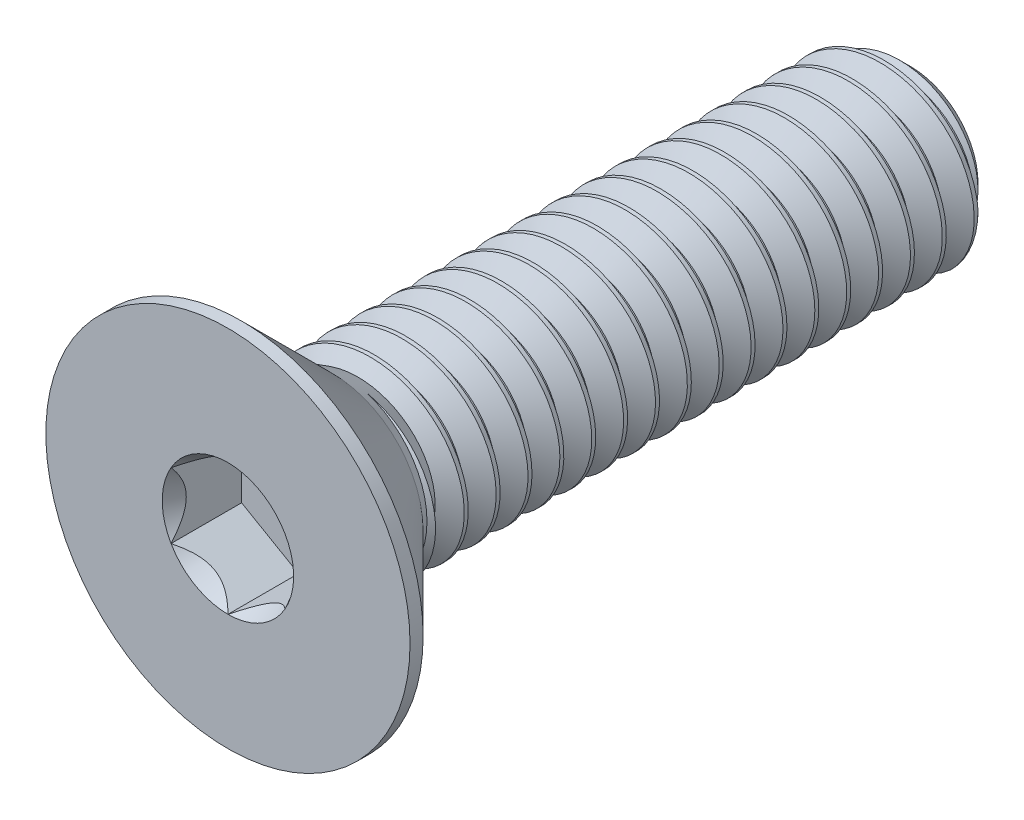
from build123d import *

# Parameters (mm, degrees)
CUT_EXTRUDE1_DEPTH = 1.55
SKETCH6_R          = 1.443375673
CUT_EXTRUDE2_DEPTH = 1.55
CUT_EXTRUDE2_DRAFT = -30
CHAMFER1_SIZE      = 0.35
CUT_SWEEP1_PITCH   = 0.7
CUT_SWEEP1_TO      = 12.7


with BuildPart() as part:
    # Sketch2 → Revolve1 (revolve)
    with BuildSketch(Plane(origin=(0, 0, 0), x_dir=(0, 0, -1), z_dir=(1, 0, 0)), mode=Mode.PRIVATE) as revolve1_sk:
        Polygon((-2.3, 0), (-2.3, 4), (-2.0125, 4), (0, 1.9875), (0, 0), align=None)
    revolve(revolve1_sk.sketch.rotate(Axis((0, 0, 0), (0, 0, -1)), 90), axis=Axis((0, 0, 0), (0, 0, -1)))

    # Sketch3 → Revolve2 (revolve)
    with BuildSketch(Plane(origin=(0, 0, 0), x_dir=(0, 0, -1), z_dir=(1, 0, 0))):
        Polygon((12.7, 0), (12.7, 1.475), (12.175, 2), (0, 2), (0, 0), align=None)
    revolve(axis=Axis((0, 0, 0), (0, 0, 1)))

    # Sketch5 → Cut-Extrude1 (cut)
    with BuildSketch(Plane.XY.offset(2.3)):
        Polygon((0, -1.443375673), (1.25, -0.721687836), (1.25, 0.721687836), (0, 1.443375673), (-1.25, 0.721687836), (-1.25, -0.721687836), align=None)
    extrude(amount=-CUT_EXTRUDE1_DEPTH, mode=Mode.SUBTRACT)


with BuildPart() as cut_extrude2_tool:
    # Sketch6 → Cut-Extrude2 (with draft: the straight prism first)
    with BuildSketch(Plane.XY.offset(2.3)):
        Circle(SKETCH6_R)
    extrude(amount=-CUT_EXTRUDE2_DEPTH)
    # Cut-Extrude2: the draft: its side faces are tilted about the plane it starts from
    cut_extrude2_sides = [cut_extrude2_tool.faces().sort_by_distance(p)[0] for p in [
        (-1.443375673, 0, 1.525),
    ]]
    draft(cut_extrude2_sides, Plane.XY.offset(2.3), CUT_EXTRUDE2_DRAFT)


with BuildPart() as part_1:
    add(part.part)

    # Cut-Extrude2: cut by cut_extrude2_tool
    add(cut_extrude2_tool.part, mode=Mode.SUBTRACT)


with BuildPart() as body_2:
    # Split1: the piece on the far side of the plane
    add(part_1.part)
    split(bisect_by=Plane.XY, keep=Keep.BOTTOM)

    # Chamfer1
    chamfer1_edges = [body_2.edges().sort_by_distance(p)[0] for p in [
        (0, -2, 0),
    ]]
    chamfer(chamfer1_edges, length=CHAMFER1_SIZE)

    # Cut-Sweep1: arcs per turn and ends read off the stored shape
    # Cut-Sweep1: the profile of Sketch8 screwed along a right-hand helix through 26.785714 turns, 6 arcs to a turn; built about Z, then put on its axis
    cut_sweep1_z = Axis((0, 0, 0), (0, 0, 1))
    cut_sweep1_corners = [(1.545336663, 0, -0.2625), (1.545336663, 0, -0.35), (2.037888611, 0, -0.634375), (2.037888611, 0, 0.021875)]
    with BuildLine(mode=Mode.PRIVATE) as cut_sweep1_profile:
        Line(cut_sweep1_corners[0], cut_sweep1_corners[1])
        Line(cut_sweep1_corners[1], cut_sweep1_corners[2])
        Line(cut_sweep1_corners[2], cut_sweep1_corners[3])
        Line(cut_sweep1_corners[3], cut_sweep1_corners[0])
    cut_sweep1_cap = Face(cut_sweep1_profile.wire())
    cut_sweep1_turn_angles = [0, 30, 60, 90, 120, 150, 180, 210, 240, 270, 300, 330, 360]
    cut_sweep1_turn_weights = [1, 0.8660254037844387, 1, 0.8660254037844387, 1, 0.8660254037844387, 1, 0.8660254037844387, 1, 0.8660254037844387, 1, 0.8660254037844387, 1]
    cut_sweep1_turn_rails = [Edge.make_bspline([Vector(p[0], p[1], 0).rotate(cut_sweep1_z, cut_sweep1_turn_angles[k]) / cut_sweep1_turn_weights[k] + Vector(0, 0, p[2] + CUT_SWEEP1_PITCH * cut_sweep1_turn_angles[k] / 360) for k in range(13)], [0, 0, 0, 1, 1, 2, 2, 3, 3, 4, 4, 5, 5, 6, 6, 6], 2, cut_sweep1_turn_weights) for p in cut_sweep1_corners]
    cut_sweep1_turn_sides = [Face.make_surface_from_curves(cut_sweep1_turn_rails[p[0]], cut_sweep1_turn_rails[p[1]]) for p in [(0, 1), (1, 2), (2, 3), (3, 0)]]
    cut_sweep1_last_angles = [9360, 9390, 9420, 9450, 9480, 9510, 9540, 9570, 9600, 9621.428571429, 9642.857142857]
    cut_sweep1_last_weights = [1, 0.8660254037844387, 1, 0.8660254037844387, 1, 0.8660254037844387, 1, 0.8660254037844387, 1, 0.9308737486442904, 1]
    cut_sweep1_last_rails = [Edge.make_bspline([Vector(p[0], p[1], 0).rotate(cut_sweep1_z, cut_sweep1_last_angles[k]) / cut_sweep1_last_weights[k] + Vector(0, 0, p[2] + CUT_SWEEP1_PITCH * cut_sweep1_last_angles[k] / 360) for k in range(11)], [0, 0, 0, 1, 1, 2, 2, 3, 3, 4, 4, 5, 5, 5], 2, cut_sweep1_last_weights) for p in cut_sweep1_corners]
    cut_sweep1_last_sides = [Face.make_surface_from_curves(cut_sweep1_last_rails[p[0]], cut_sweep1_last_rails[p[1]]) for p in [(0, 1), (1, 2), (2, 3), (3, 0)]]
    cut_sweep1 = Plane(origin=(0, 0, -12.7), x_dir=(0, 1, 0), z_dir=(0, 0, 1)) * split(Solid(Shell([*[p.moved(Location((0, 0, CUT_SWEEP1_PITCH * i))) for i in range(26) for p in cut_sweep1_turn_sides], *cut_sweep1_last_sides, cut_sweep1_cap, cut_sweep1_cap.rotate(cut_sweep1_z, 9642.857142857).moved(Location((0, 0, CUT_SWEEP1_PITCH * 9642.857142857 / 360)))])), bisect_by=Plane.XY.offset(CUT_SWEEP1_TO), keep=Keep.BOTTOM, mode=Mode.PRIVATE)
    add(cut_sweep1, mode=Mode.SUBTRACT)


with BuildPart() as part_2:
    add(part_1.part)

    # Split1
    split(bisect_by=Plane.XY, keep=Keep.TOP)

    add(body_2.part)  # Boss-Extrude1 merges body 2
    # Boss-Extrude1 cone 1 section (through the dimple's axis) → Boss-Extrude1 (revolve)
    with BuildSketch(Plane(origin=(0, 0, 0), x_dir=(0, -1, 0), z_dir=(1, 0, 0))):
        Polygon((0, 0), (1.9875, 0), (0, 3.320870511), align=None)
    revolve(axis=Axis((0, 0, 0), (0, 0, -1)))


solid = part_2.part
